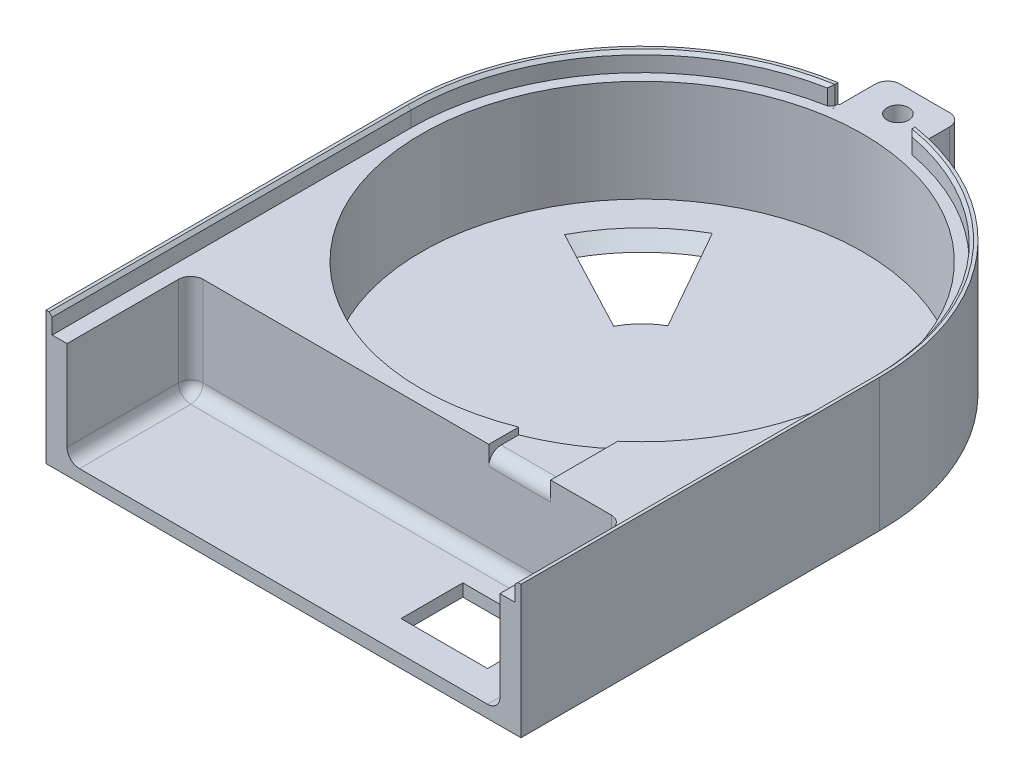
from build123d import *

# Parameters (mm, degrees)
BOSS_EXTRUDE1_DEPTH = 2
SKETCH3_R           = 35.7
BOSS_EXTRUDE2_DEPTH = 18.5
SKETCH5_W           = 12
SKETCH5_H           = 10
SKETCH5_R           = 1.75
BOSS_EXTRUDE3_DEPTH = 18.5
SKETCH6_R           = 36.4
BOSS_EXTRUDE5_DEPTH = 18.5
BOSS_EXTRUDE6_DEPTH = 21.5
SKETCH8_W           = 12.454054054
SKETCH8_H           = 5
CUT_EXTRUDE1_DEPTH  = 12
SKETCH9_W           = 10
SKETCH9_H           = 3
CUT_EXTRUDE2_DEPTH  = 21
CHAMFER1_SIZE       = 0.5
FILLET1_R           = 2
CHAMFER2_SIZE       = 2
SKETCH10_W          = 14
SKETCH10_H          = 10
CUT_EXTRUDE3_DEPTH  = 13


# Some blends are built 0.0001 mm under size
with BuildPart() as part:
    # Sketch4 → Boss-Extrude1 (new body)
    with BuildSketch(Plane(origin=(0, 0, 0), x_dir=(1, 0, 0), z_dir=(0, 1, 0))):
        with BuildLine():
            Line((37, 0), (37, -58))
            Line((37, -58), (-37, -58))
            Line((-37, -58), (-37, 0))
            ThreePointArc((-37, 0), (0, 37), (37, 0))
        make_face()
        with BuildLine():
            Line((-11.5, 6.062177826), (-24.769230769, 13.056998396))
            ThreePointArc((-24.769230769, 13.056998396), (-20.089945679, 19.503694076), (-13.784615385, 24.371794737))
            Line((-13.784615385, 24.371794737), (-6.4, 11.315476128))
            ThreePointArc((-6.4, 11.315476128), (-9.327474779, 9.055286535), (-11.5, 6.062177826))
        make_face(mode=Mode.SUBTRACT)
    extrude(amount=BOSS_EXTRUDE1_DEPTH)

    # Sketch3 → Boss-Extrude2 (add)
    with BuildSketch(Plane(origin=(0, 0, 0), x_dir=(1, 0, 0), z_dir=(0, 1, 0))):
        with BuildLine():
            Line((-37, 0), (-37, -58))
            Line((-37, -58), (-35, -58))
            Line((-35, -58), (-35, -38))
            Line((-35, -38), (35, -38))
            Line((35, -38), (35, -58))
            Line((35, -58), (37, -58))
            Line((37, -58), (37, 0))
            ThreePointArc((37, 0), (0, 37), (-37, 0))
        make_face()
        with Locations(Location((0, 0, 0), (0, 0, 270))):
            Circle(SKETCH3_R, mode=Mode.SUBTRACT)
    extrude(amount=BOSS_EXTRUDE2_DEPTH)

    # Sketch5 → Boss-Extrude3 (add)
    with BuildSketch(Plane(origin=(0, 0, 0), x_dir=(1, 0, 0), z_dir=(0, 1, 0))):
        with Locations((0, 40.7)):
            Rectangle(SKETCH5_W, SKETCH5_H)
        with Locations(Location((0, 41.35, 0), (0, 0, 270))):
            Circle(SKETCH5_R, mode=Mode.SUBTRACT)
    extrude(amount=BOSS_EXTRUDE3_DEPTH)

    # Sketch6 → Boss-Extrude5 (add)
    with BuildSketch(Plane(origin=(0, 0, 0), x_dir=(-1, 0, 0), z_dir=(0, 1, 0))):
        with BuildLine():
            Line((37.4, 0), (37.4, 58))
            Line((37.4, 58), (35, 58))
            Line((35, 58), (35, 38))
            Line((35, 38), (-35, 38))
            Line((-35, 38), (-35, 58))
            Line((-35, 58), (-37.4, 58))
            Line((-37.4, 58), (-37.4, 0))
            ThreePointArc((-37.4, 0), (-28.50952425, -24.206755814), (-6.064864865, -36.904978176))
            Line((-6.064864865, -36.904978176), (6.064864865, -36.904978176))
            ThreePointArc((6.064864865, -36.904978176), (28.50952425, -24.206755814), (37.4, 0))
        make_face()
        Circle(SKETCH6_R, mode=Mode.SUBTRACT)
    extrude(amount=BOSS_EXTRUDE5_DEPTH)

    # Sketch7 → Boss-Extrude6 (add)
    with BuildSketch(Plane(origin=(0, 0, 0), x_dir=(1, 0, 0), z_dir=(0, 1, 0))):
        with BuildLine():
            Line((37.4, 0), (37.4, -58))
            Line((37.4, -58), (38.4, -58))
            Line((38.4, -58), (38.4, 0))
            ThreePointArc((38.4, 0), (29.271810995, 24.853995274), (6.227027027, 37.891742298))
            Line((6.227027027, 37.891742298), (-6.227027027, 37.891742298))
            ThreePointArc((-6.227027027, 37.891742298), (-29.271810995, 24.853995274), (-38.4, 0))
            Line((-38.4, 0), (-38.4, -58))
            Line((-38.4, -58), (-37.4, -58))
            Line((-37.4, -58), (-37.4, 0))
            ThreePointArc((-37.4, 0), (0, 37.4), (37.4, 0))
        make_face()
    extrude(amount=BOSS_EXTRUDE6_DEPTH)

    # Sketch8 → Cut-Extrude1 (cut)
    with BuildSketch(Plane(origin=(0, 0, -45.7), x_dir=(-1, 0, 0), z_dir=(0, 0, -1))):
        with Locations((0, 21)):
            Rectangle(SKETCH8_W, SKETCH8_H)
    extrude(amount=-CUT_EXTRUDE1_DEPTH, mode=Mode.SUBTRACT)

    # Sketch9 → Cut-Extrude2 (cut)
    with BuildSketch(Plane.XY.offset(38)):
        with Locations((18.2, 18.9)):
            Rectangle(SKETCH9_W, SKETCH9_H)
    extrude(amount=-CUT_EXTRUDE2_DEPTH, mode=Mode.SUBTRACT)

    # Chamfer1
    # the kernel refuses this chamfer: 0.610095567, 0.5 mm, written as the material it takes off along each edge
    with BuildSketch(Plane(origin=(6.227027027, 23.093595243, -36.87796272), x_dir=(0, 0, -1), z_dir=(0, -1, 0))) as chamfer1_piece_1:
        with BuildLine():
            Line((CHAMFER1_SIZE, 0), (-0.10779544, 0.60779544))
            ThreePointArc((-0.10779544, 0.60779544), (-0.054392136, 0.313970558), (0, 0))
            Line((0, 0), (CHAMFER1_SIZE, 0))
        make_face()
    extrude(amount=4.593595243, mode=Mode.SUBTRACT)
    with BuildSketch(Plane(origin=(-6.227027027, 23.093595243, -36.87796272), x_dir=(-0.9846341969659582, 0, 0.17462960277456552), z_dir=(0, -1, 0))) as chamfer1_piece_2:
        with BuildLine():
            Line((0.61728045, 0), (-CHAMFER1_SIZE * 0.174629602775, CHAMFER1_SIZE * 0.984634196966))
            Line((-CHAMFER1_SIZE * 0.174629602775, CHAMFER1_SIZE * 0.984634196966), (0, 0))
            ThreePointArc((0, 0), (0.318644625, 0.001272197), (0.61728045, 0))
        make_face()
    extrude(amount=4.593595243, mode=Mode.SUBTRACT)
    # the kernel refuses this chamfer: 0.610095567, 0.5 mm, written as the material it takes off along each edge
    with BuildSketch(Plane(origin=(-37.4, 21.5, 59.285841494), x_dir=(-1, 0, 0), z_dir=(0, 0, -1)), Plane(origin=(37.4, 21.5, 0), x_dir=(1, 0, 0), z_dir=(0, 0, 1))) as chamfer1_2_piece_1:
        Polygon((CHAMFER1_SIZE, 0), (0, -CHAMFER1_SIZE), (0, 0), align=None)
    extrude(amount=59.285841494, mode=Mode.SUBTRACT)
    with BuildSketch(Plane(origin=(0, 21.5, 0), x_dir=(-1, 0, 0), z_dir=(0, 0, 1))) as chamfer1_2_piece_2:
        Polygon((37.4 + CHAMFER1_SIZE, 0), (37.4, CHAMFER1_SIZE), (37.4, 0), align=None)
    revolve(axis=Axis((0, 21.5, 0), (0, -1, 0)), revolution_arc=81.44055325, mode=Mode.SUBTRACT)
    with BuildSketch(Plane(origin=(0, 21.5, 0), x_dir=(0.14883547640098224, 0, -0.9888619726556849), z_dir=(-0.9888619726556849, 0, -0.14883547640098224))) as chamfer1_2_piece_3:
        Polygon((37.4 + CHAMFER1_SIZE, 0), (37.4, CHAMFER1_SIZE), (37.4, 0), align=None)
    revolve(axis=Axis((0, 21.5, 0), (0, -1, 0)), revolution_arc=81.44055325, mode=Mode.SUBTRACT)

    # Fillet1
    fillet1_edges = [part.edges().sort_by_distance(p)[0] for p in [
        (6, 0, -41.795871149),
        (18.2, 17.4, 38),
        (0, 2, 38),
        (-35, 2, 48),
        (35, 2, 48),
        (-35, 10.25, 38),
        (35, 10.25, 38),
        (-6, 0, -41.795871149),
        (-6, 9.25, -45.7),
        (6, 9.25, -45.7),
        (0, 0, -45.7),
    ]]
    fillet(fillet1_edges, radius=FILLET1_R)

    # Chamfer2
    chamfer2_edges = [part.edges().sort_by_distance(p)[0] for p in [
        (-20.089945679, 2, -19.503694076),
        (-9.327474779, 2, -9.055286535),
    ]]
    chamfer(chamfer2_edges, length=CHAMFER2_SIZE - 0.0001)  # a hair under: the kernel refuses the full size

    # Sketch10 → Cut-Extrude3 (cut)
    with BuildSketch(Plane(origin=(0, 0, 0), x_dir=(1, 0, 0), z_dir=(0, 1, 0))):
        with Locations((21, -48)):
            Rectangle(SKETCH10_W, SKETCH10_H)
    extrude(amount=CUT_EXTRUDE3_DEPTH, mode=Mode.SUBTRACT)


solid = part.part
